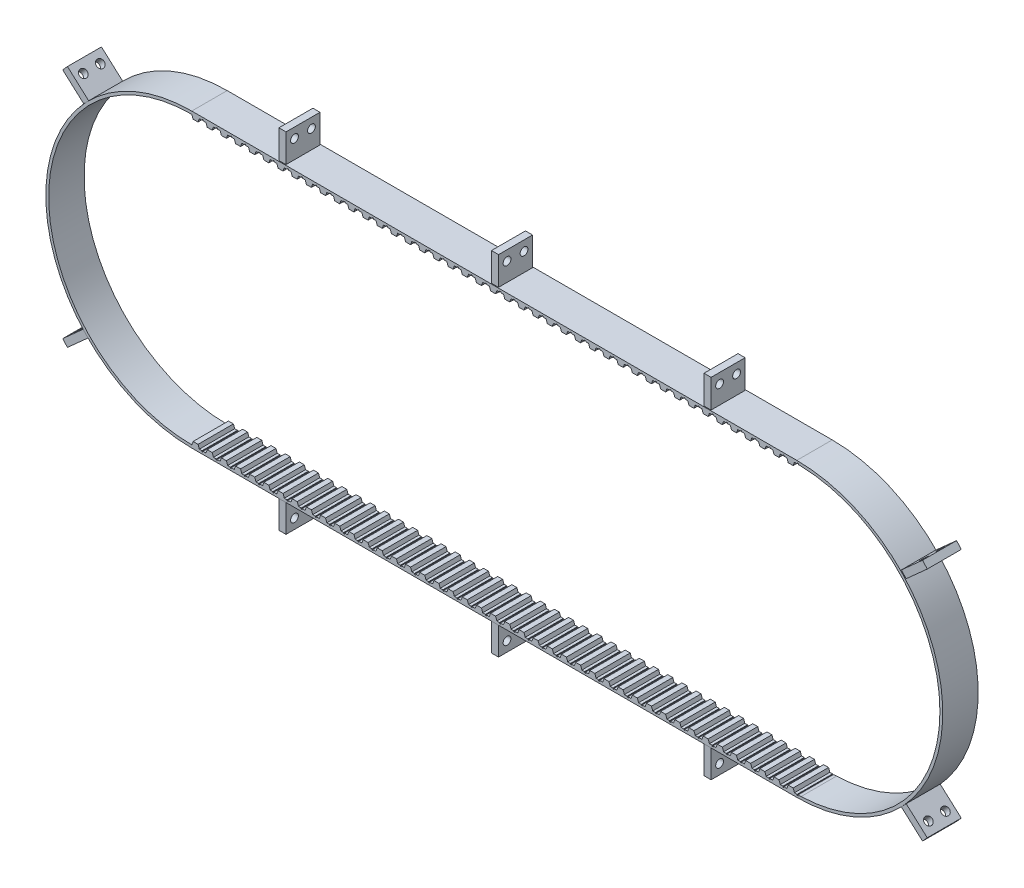
from build123d import *

# Parameters (mm, degrees)
EXTRUDE_1_DEPTH      = 12.5
SKETCH_3_W           = 24
SKETCH_3_H           = 20
SKETCH_3_R           = 2.75
EXTRUDE_2_DEPTH      = 2.5
SKETCH_4_W           = 5
SKETCH_4_H           = 20
EXTRUDE_3_DEPTH      = 24
SKETCH_6_R           = 2.75
CUT_EXTRUDE_2_DEPTH  = 5
SKETCH_5_R           = 2.75
CUT_EXTRUDE_3_DEPTH  = 343.120227406
MIRROR_START         = -152.5
MIRROR_2_OUTLINE_W   = 20
MIRROR_2_OUTLINE_H   = 24
MIRROR_2_OUTLINE_R   = 2.75
MIRROR_2_DEPTH       = 5
MIRROR_START_2       = -2.5
MIRROR_2_2_OUTLINE_W = 20
MIRROR_2_2_OUTLINE_H = 24
MIRROR_2_2_OUTLINE_R = 2.75
MIRROR_2_2_DEPTH     = 5
MIRROR_START_3       = 147.5
MIRROR_2_3_OUTLINE_W = 20
MIRROR_2_3_OUTLINE_H = 24
MIRROR_2_3_OUTLINE_R = 2.75
MIRROR_2_3_DEPTH     = 5
MIRROR_START_4       = 137.535094619
MIRROR_2_4_OUTLINE_W = 20.95281313
MIRROR_2_4_OUTLINE_H = 24
MIRROR_2_4_OUTLINE_R = 2.75
MIRROR_2_4_DEPTH     = 5
MIRROR_START_5       = -142.535094619
MIRROR_2_5_OUTLINE_W = 20.95281313
MIRROR_2_5_OUTLINE_H = 24
MIRROR_2_5_OUTLINE_R = 2.75
MIRROR_2_5_DEPTH     = 5


# Read off the part's stored shape, not the designer's step: 镜向2
with BuildPart() as part:
    # 草图1 → 凸台-拉伸1 (new, symmetric)
    with BuildSketch(Plane.XY):
        with BuildLine():
            Line((-213.5, 103), (213.5, 103))
            ThreePointArc((213.5, 103), (316.5, 0), (213.5, -103))
            Line((213.5, -103), (-213.5, -103))
            ThreePointArc((-213.5, -103), (-316.5, 0), (-213.5, 103))
        make_face()
        with BuildLine():
            Line((-213.5, 101), (-212.590074414, 98.5))
            Line((-212.590074414, 98.5), (-209.090074414, 98.5))
            Line((-209.090074414, 98.5), (-208.180148829, 101))
            Line((-208.180148829, 101), (-206.280148829, 101))
            Line((-206.280148829, 101), (-206.280148829, 101.59))
            Line((-206.280148829, 101.59), (-205.4, 101.59))
            Line((-205.4, 101.59), (-205.4, 101))
            Line((-205.4, 101), (-203.5, 101))
            Line((-203.5, 101), (-202.590074414, 98.5))
            Line((-202.590074414, 98.5), (-199.090074414, 98.5))
            Line((-199.090074414, 98.5), (-198.180148829, 101))
            Line((-198.180148829, 101), (-196.280148829, 101))
            Line((-196.280148829, 101), (-196.280148829, 101.59))
            Line((-196.280148829, 101.59), (-195.4, 101.59))
            Line((-195.4, 101.59), (-195.4, 101))
            Line((-195.4, 101), (-193.5, 101))
            Line((-193.5, 101), (-192.590074414, 98.5))
            Line((-192.590074414, 98.5), (-189.090074414, 98.5))
            Line((-189.090074414, 98.5), (-188.180148829, 101))
            Line((-188.180148829, 101), (-186.280148829, 101))
            Line((-186.280148829, 101), (-186.280148829, 101.59))
            Line((-186.280148829, 101.59), (-185.4, 101.59))
            Line((-185.4, 101.59), (-185.4, 101))
            Line((-185.4, 101), (-183.5, 101))
            Line((-183.5, 101), (-182.590074414, 98.5))
            Line((-182.590074414, 98.5), (-179.090074414, 98.5))
            Line((-179.090074414, 98.5), (-178.180148829, 101))
            Line((-178.180148829, 101), (-176.280148829, 101))
            Line((-176.280148829, 101), (-176.280148829, 101.59))
            Line((-176.280148829, 101.59), (-175.4, 101.59))
            Line((-175.4, 101.59), (-175.4, 101))
            Line((-175.4, 101), (-173.5, 101))
            Line((-173.5, 101), (-172.590074414, 98.5))
            Line((-172.590074414, 98.5), (-169.090074414, 98.5))
            Line((-169.090074414, 98.5), (-168.180148829, 101))
            Line((-168.180148829, 101), (-166.280148829, 101))
            Line((-166.280148829, 101), (-166.280148829, 101.59))
            Line((-166.280148829, 101.59), (-165.4, 101.59))
            Line((-165.4, 101.59), (-165.4, 101))
            Line((-165.4, 101), (-163.5, 101))
            Line((-163.5, 101), (-162.590074414, 98.5))
            Line((-162.590074414, 98.5), (-159.090074414, 98.5))
            Line((-159.090074414, 98.5), (-158.180148829, 101))
            Line((-158.180148829, 101), (-156.280148829, 101))
            Line((-156.280148829, 101), (-156.280148829, 101.59))
            Line((-156.280148829, 101.59), (-155.4, 101.59))
            Line((-155.4, 101.59), (-155.4, 101))
            Line((-155.4, 101), (-153.5, 101))
            Line((-153.5, 101), (-152.590074414, 98.5))
            Line((-152.590074414, 98.5), (-149.090074414, 98.5))
            Line((-149.090074414, 98.5), (-148.180148829, 101))
            Line((-148.180148829, 101), (-146.280148829, 101))
            Line((-146.280148829, 101), (-146.280148829, 101.59))
            Line((-146.280148829, 101.59), (-145.4, 101.59))
            Line((-145.4, 101.59), (-145.4, 101))
            Line((-145.4, 101), (-143.5, 101))
            Line((-143.5, 101), (-142.590074414, 98.5))
            Line((-142.590074414, 98.5), (-139.090074414, 98.5))
            Line((-139.090074414, 98.5), (-138.180148829, 101))
            Line((-138.180148829, 101), (-136.280148829, 101))
            Line((-136.280148829, 101), (-136.280148829, 101.59))
            Line((-136.280148829, 101.59), (-135.4, 101.59))
            Line((-135.4, 101.59), (-135.4, 101))
            Line((-135.4, 101), (-133.5, 101))
            Line((-133.5, 101), (-132.590074414, 98.5))
            Line((-132.590074414, 98.5), (-129.090074414, 98.5))
            Line((-129.090074414, 98.5), (-128.180148829, 101))
            Line((-128.180148829, 101), (-126.280148829, 101))
            Line((-126.280148829, 101), (-126.280148829, 101.59))
            Line((-126.280148829, 101.59), (-125.4, 101.59))
            Line((-125.4, 101.59), (-125.4, 101))
            Line((-125.4, 101), (-123.5, 101))
            Line((-123.5, 101), (-122.590074414, 98.5))
            Line((-122.590074414, 98.5), (-119.090074414, 98.5))
            Line((-119.090074414, 98.5), (-118.180148829, 101))
            Line((-118.180148829, 101), (-116.280148829, 101))
            Line((-116.280148829, 101), (-116.280148829, 101.59))
            Line((-116.280148829, 101.59), (-115.4, 101.59))
            Line((-115.4, 101.59), (-115.4, 101))
            Line((-115.4, 101), (-113.5, 101))
            Line((-113.5, 101), (-112.590074414, 98.5))
            Line((-112.590074414, 98.5), (-109.090074414, 98.5))
            Line((-109.090074414, 98.5), (-108.180148829, 101))
            Line((-108.180148829, 101), (-106.280148829, 101))
            Line((-106.280148829, 101), (-106.280148829, 101.59))
            Line((-106.280148829, 101.59), (-105.4, 101.59))
            Line((-105.4, 101.59), (-105.4, 101))
            Line((-105.4, 101), (-103.5, 101))
            Line((-103.5, 101), (-102.590074414, 98.5))
            Line((-102.590074414, 98.5), (-99.090074414, 98.5))
            Line((-99.090074414, 98.5), (-98.180148829, 101))
            Line((-98.180148829, 101), (-96.280148829, 101))
            Line((-96.280148829, 101), (-96.280148829, 101.59))
            Line((-96.280148829, 101.59), (-95.4, 101.59))
            Line((-95.4, 101.59), (-95.4, 101))
            Line((-95.4, 101), (-93.5, 101))
            Line((-93.5, 101), (-92.590074414, 98.5))
            Line((-92.590074414, 98.5), (-89.090074414, 98.5))
            Line((-89.090074414, 98.5), (-88.180148829, 101))
            Line((-88.180148829, 101), (-86.280148829, 101))
            Line((-86.280148829, 101), (-86.280148829, 101.59))
            Line((-86.280148829, 101.59), (-85.4, 101.59))
            Line((-85.4, 101.59), (-85.4, 101))
            Line((-85.4, 101), (-83.5, 101))
            Line((-83.5, 101), (-82.590074414, 98.5))
            Line((-82.590074414, 98.5), (-79.090074414, 98.5))
            Line((-79.090074414, 98.5), (-78.180148829, 101))
            Line((-78.180148829, 101), (-76.280148829, 101))
            Line((-76.280148829, 101), (-76.280148829, 101.59))
            Line((-76.280148829, 101.59), (-75.4, 101.59))
            Line((-75.4, 101.59), (-75.4, 101))
            Line((-75.4, 101), (-73.5, 101))
            Line((-73.5, 101), (-72.590074414, 98.5))
            Line((-72.590074414, 98.5), (-69.090074414, 98.5))
            Line((-69.090074414, 98.5), (-68.180148829, 101))
            Line((-68.180148829, 101), (-66.280148829, 101))
            Line((-66.280148829, 101), (-66.280148829, 101.59))
            Line((-66.280148829, 101.59), (-65.4, 101.59))
            Line((-65.4, 101.59), (-65.4, 101))
            Line((-65.4, 101), (-63.5, 101))
            Line((-63.5, 101), (-62.590074414, 98.5))
            Line((-62.590074414, 98.5), (-59.090074414, 98.5))
            Line((-59.090074414, 98.5), (-58.180148829, 101))
            Line((-58.180148829, 101), (-56.280148829, 101))
            Line((-56.280148829, 101), (-56.280148829, 101.59))
            Line((-56.280148829, 101.59), (-55.4, 101.59))
            Line((-55.4, 101.59), (-55.4, 101))
            Line((-55.4, 101), (-53.5, 101))
            Line((-53.5, 101), (-52.590074414, 98.5))
            Line((-52.590074414, 98.5), (-49.090074414, 98.5))
            Line((-49.090074414, 98.5), (-48.180148829, 101))
            Line((-48.180148829, 101), (-46.280148829, 101))
            Line((-46.280148829, 101), (-46.280148829, 101.59))
            Line((-46.280148829, 101.59), (-45.4, 101.59))
            Line((-45.4, 101.59), (-45.4, 101))
            Line((-45.4, 101), (-43.5, 101))
            Line((-43.5, 101), (-42.590074414, 98.5))
            Line((-42.590074414, 98.5), (-39.090074414, 98.5))
            Line((-39.090074414, 98.5), (-38.180148829, 101))
            Line((-38.180148829, 101), (-36.280148829, 101))
            Line((-36.280148829, 101), (-36.280148829, 101.59))
            Line((-36.280148829, 101.59), (-35.4, 101.59))
            Line((-35.4, 101.59), (-35.4, 101))
            Line((-35.4, 101), (-33.5, 101))
            Line((-33.5, 101), (-32.590074414, 98.5))
            Line((-32.590074414, 98.5), (-29.090074414, 98.5))
            Line((-29.090074414, 98.5), (-28.180148829, 101))
            Line((-28.180148829, 101), (-26.280148829, 101))
            Line((-26.280148829, 101), (-26.280148829, 101.59))
            Line((-26.280148829, 101.59), (-25.4, 101.59))
            Line((-25.4, 101.59), (-25.4, 101))
            Line((-25.4, 101), (-23.5, 101))
            Line((-23.5, 101), (-22.590074414, 98.5))
            Line((-22.590074414, 98.5), (-19.090074414, 98.5))
            Line((-19.090074414, 98.5), (-18.180148829, 101))
            Line((-18.180148829, 101), (-16.280148829, 101))
            Line((-16.280148829, 101), (-16.280148829, 101.59))
            Line((-16.280148829, 101.59), (-15.4, 101.59))
            Line((-15.4, 101.59), (-15.4, 101))
            Line((-15.4, 101), (-13.5, 101))
            Line((-13.5, 101), (-12.590074414, 98.5))
            Line((-12.590074414, 98.5), (-9.090074414, 98.5))
            Line((-9.090074414, 98.5), (-8.180148829, 101))
            Line((-8.180148829, 101), (-6.280148829, 101))
            Line((-6.280148829, 101), (-6.280148829, 101.59))
            Line((-6.280148829, 101.59), (-5.4, 101.59))
            Line((-5.4, 101.59), (-5.4, 101))
            Line((-5.4, 101), (-3.5, 101))
            Line((-3.5, 101), (-2.590074414, 98.5))
            Line((-2.590074414, 98.5), (0.909925586, 98.5))
            Line((0.909925586, 98.5), (1.819851171, 101))
            Line((1.819851171, 101), (3.719851171, 101))
            Line((3.719851171, 101), (3.719851171, 101.59))
            Line((3.719851171, 101.59), (4.6, 101.59))
            Line((4.6, 101.59), (4.6, 101))
            Line((4.6, 101), (6.5, 101))
            Line((6.5, 101), (7.409925586, 98.5))
            Line((7.409925586, 98.5), (10.909925586, 98.5))
            Line((10.909925586, 98.5), (11.819851171, 101))
            Line((11.819851171, 101), (13.719851171, 101))
            Line((13.719851171, 101), (13.719851171, 101.59))
            Line((13.719851171, 101.59), (14.6, 101.59))
            Line((14.6, 101.59), (14.6, 101))
            Line((14.6, 101), (16.5, 101))
            Line((16.5, 101), (17.409925586, 98.5))
            Line((17.409925586, 98.5), (20.909925586, 98.5))
            Line((20.909925586, 98.5), (21.819851171, 101))
            Line((21.819851171, 101), (23.719851171, 101))
            Line((23.719851171, 101), (23.719851171, 101.59))
            Line((23.719851171, 101.59), (24.6, 101.59))
            Line((24.6, 101.59), (24.6, 101))
            Line((24.6, 101), (26.5, 101))
            Line((26.5, 101), (27.409925586, 98.5))
            Line((27.409925586, 98.5), (30.909925586, 98.5))
            Line((30.909925586, 98.5), (31.819851171, 101))
            Line((31.819851171, 101), (33.719851171, 101))
            Line((33.719851171, 101), (33.719851171, 101.59))
            Line((33.719851171, 101.59), (34.6, 101.59))
            Line((34.6, 101.59), (34.6, 101))
            Line((34.6, 101), (36.5, 101))
            Line((36.5, 101), (37.409925586, 98.5))
            Line((37.409925586, 98.5), (40.909925586, 98.5))
            Line((40.909925586, 98.5), (41.819851171, 101))
            Line((41.819851171, 101), (43.719851171, 101))
            Line((43.719851171, 101), (43.719851171, 101.59))
            Line((43.719851171, 101.59), (44.6, 101.59))
            Line((44.6, 101.59), (44.6, 101))
            Line((44.6, 101), (46.5, 101))
            Line((46.5, 101), (47.409925586, 98.5))
            Line((47.409925586, 98.5), (50.909925586, 98.5))
            Line((50.909925586, 98.5), (51.819851171, 101))
            Line((51.819851171, 101), (53.719851171, 101))
            Line((53.719851171, 101), (53.719851171, 101.59))
            Line((53.719851171, 101.59), (54.6, 101.59))
            Line((54.6, 101.59), (54.6, 101))
            Line((54.6, 101), (56.5, 101))
            Line((56.5, 101), (57.409925586, 98.5))
            Line((57.409925586, 98.5), (60.909925586, 98.5))
            Line((60.909925586, 98.5), (61.819851171, 101))
            Line((61.819851171, 101), (63.719851171, 101))
            Line((63.719851171, 101), (63.719851171, 101.59))
            Line((63.719851171, 101.59), (64.6, 101.59))
            Line((64.6, 101.59), (64.6, 101))
            Line((64.6, 101), (66.5, 101))
            Line((66.5, 101), (67.409925586, 98.5))
            Line((67.409925586, 98.5), (70.909925586, 98.5))
            Line((70.909925586, 98.5), (71.819851171, 101))
            Line((71.819851171, 101), (73.719851171, 101))
            Line((73.719851171, 101), (73.719851171, 101.59))
            Line((73.719851171, 101.59), (74.6, 101.59))
            Line((74.6, 101.59), (74.6, 101))
            Line((74.6, 101), (76.5, 101))
            Line((76.5, 101), (77.409925586, 98.5))
            Line((77.409925586, 98.5), (80.909925586, 98.5))
            Line((80.909925586, 98.5), (81.819851171, 101))
            Line((81.819851171, 101), (83.719851171, 101))
            Line((83.719851171, 101), (83.719851171, 101.59))
            Line((83.719851171, 101.59), (84.6, 101.59))
            Line((84.6, 101.59), (84.6, 101))
            Line((84.6, 101), (86.5, 101))
            Line((86.5, 101), (87.409925586, 98.5))
            Line((87.409925586, 98.5), (90.909925586, 98.5))
            Line((90.909925586, 98.5), (91.819851171, 101))
            Line((91.819851171, 101), (93.719851171, 101))
            Line((93.719851171, 101), (93.719851171, 101.59))
            Line((93.719851171, 101.59), (94.6, 101.59))
            Line((94.6, 101.59), (94.6, 101))
            Line((94.6, 101), (96.5, 101))
            Line((96.5, 101), (97.409925586, 98.5))
            Line((97.409925586, 98.5), (100.909925586, 98.5))
            Line((100.909925586, 98.5), (101.819851171, 101))
            Line((101.819851171, 101), (103.719851171, 101))
            Line((103.719851171, 101), (103.719851171, 101.59))
            Line((103.719851171, 101.59), (104.6, 101.59))
            Line((104.6, 101.59), (104.6, 101))
            Line((104.6, 101), (106.5, 101))
            Line((106.5, 101), (107.409925586, 98.5))
            Line((107.409925586, 98.5), (110.909925586, 98.5))
            Line((110.909925586, 98.5), (111.819851171, 101))
            Line((111.819851171, 101), (113.719851171, 101))
            Line((113.719851171, 101), (113.719851171, 101.59))
            Line((113.719851171, 101.59), (114.6, 101.59))
            Line((114.6, 101.59), (114.6, 101))
            Line((114.6, 101), (116.5, 101))
            Line((116.5, 101), (117.409925586, 98.5))
            Line((117.409925586, 98.5), (120.909925586, 98.5))
            Line((120.909925586, 98.5), (121.819851171, 101))
            Line((121.819851171, 101), (123.719851171, 101))
            Line((123.719851171, 101), (123.719851171, 101.59))
            Line((123.719851171, 101.59), (124.6, 101.59))
            Line((124.6, 101.59), (124.6, 101))
            Line((124.6, 101), (126.5, 101))
            Line((126.5, 101), (127.409925586, 98.5))
            Line((127.409925586, 98.5), (130.909925586, 98.5))
            Line((130.909925586, 98.5), (131.819851171, 101))
            Line((131.819851171, 101), (133.719851171, 101))
            Line((133.719851171, 101), (133.719851171, 101.59))
            Line((133.719851171, 101.59), (134.6, 101.59))
            Line((134.6, 101.59), (134.6, 101))
            Line((134.6, 101), (136.5, 101))
            Line((136.5, 101), (137.409925586, 98.5))
            Line((137.409925586, 98.5), (140.909925586, 98.5))
            Line((140.909925586, 98.5), (141.819851171, 101))
            Line((141.819851171, 101), (143.719851171, 101))
            Line((143.719851171, 101), (143.719851171, 101.59))
            Line((143.719851171, 101.59), (144.6, 101.59))
            Line((144.6, 101.59), (144.6, 101))
            Line((144.6, 101), (146.5, 101))
            Line((146.5, 101), (147.409925586, 98.5))
            Line((147.409925586, 98.5), (150.909925586, 98.5))
            Line((150.909925586, 98.5), (151.819851171, 101))
            Line((151.819851171, 101), (153.719851171, 101))
            Line((153.719851171, 101), (153.719851171, 101.59))
            Line((153.719851171, 101.59), (154.6, 101.59))
            Line((154.6, 101.59), (154.6, 101))
            Line((154.6, 101), (156.5, 101))
            Line((156.5, 101), (157.409925586, 98.5))
            Line((157.409925586, 98.5), (160.909925586, 98.5))
            Line((160.909925586, 98.5), (161.819851171, 101))
            Line((161.819851171, 101), (163.719851171, 101))
            Line((163.719851171, 101), (163.719851171, 101.59))
            Line((163.719851171, 101.59), (164.6, 101.59))
            Line((164.6, 101.59), (164.6, 101))
            Line((164.6, 101), (166.5, 101))
            Line((166.5, 101), (167.409925586, 98.5))
            Line((167.409925586, 98.5), (170.909925586, 98.5))
            Line((170.909925586, 98.5), (171.819851171, 101))
            Line((171.819851171, 101), (173.719851171, 101))
            Line((173.719851171, 101), (173.719851171, 101.59))
            Line((173.719851171, 101.59), (174.6, 101.59))
            Line((174.6, 101.59), (174.6, 101))
            Line((174.6, 101), (176.5, 101))
            Line((176.5, 101), (177.409925586, 98.5))
            Line((177.409925586, 98.5), (180.909925586, 98.5))
            Line((180.909925586, 98.5), (181.819851171, 101))
            Line((181.819851171, 101), (183.719851171, 101))
            Line((183.719851171, 101), (183.719851171, 101.59))
            Line((183.719851171, 101.59), (184.6, 101.59))
            Line((184.6, 101.59), (184.6, 101))
            Line((184.6, 101), (186.5, 101))
            Line((186.5, 101), (187.409925586, 98.5))
            Line((187.409925586, 98.5), (190.909925586, 98.5))
            Line((190.909925586, 98.5), (191.819851171, 101))
            Line((191.819851171, 101), (193.719851171, 101))
            Line((193.719851171, 101), (193.719851171, 101.59))
            Line((193.719851171, 101.59), (194.6, 101.59))
            Line((194.6, 101.59), (194.6, 101))
            Line((194.6, 101), (196.5, 101))
            Line((196.5, 101), (197.409925586, 98.5))
            Line((197.409925586, 98.5), (200.909925586, 98.5))
            Line((200.909925586, 98.5), (201.819851171, 101))
            Line((201.819851171, 101), (203.719851171, 101))
            Line((203.719851171, 101), (203.719851171, 101.59))
            Line((203.719851171, 101.59), (204.6, 101.59))
            Line((204.6, 101.59), (204.6, 101))
            Line((204.6, 101), (206.5, 101))
            Line((206.5, 101), (207.409925586, 98.5))
            Line((207.409925586, 98.5), (210.909925586, 98.5))
            Line((210.909925586, 98.5), (211.819851171, 101))
            Line((211.819851171, 101), (213.719851171, 101))
            Line((213.719851171, 101), (213.719851171, 101.59))
            Line((213.719851171, 101.59), (214.6, 101.59))
            Line((214.6, 101.59), (214.6, 101))
            Line((214.6, 101), (216.5, 101))
            Line((216.5, 101), (216.516397915, 100.954947098))
            ThreePointArc((216.516397915, 100.954947098), (314.5, 0), (216.516397915, -100.954947098))
            Line((216.516397915, -100.954947098), (216.5, -101))
            Line((216.5, -101), (214.6, -101))
            Line((214.6, -101), (214.6, -101.59))
            Line((214.6, -101.59), (213.719851171, -101.59))
            Line((213.719851171, -101.59), (213.719851171, -101))
            Line((213.719851171, -101), (211.819851171, -101))
            Line((211.819851171, -101), (210.909925586, -98.5))
            Line((210.909925586, -98.5), (207.409925586, -98.5))
            Line((207.409925586, -98.5), (206.5, -101))
            Line((206.5, -101), (204.6, -101))
            Line((204.6, -101), (204.6, -101.59))
            Line((204.6, -101.59), (203.719851171, -101.59))
            Line((203.719851171, -101.59), (203.719851171, -101))
            Line((203.719851171, -101), (201.819851171, -101))
            Line((201.819851171, -101), (200.909925586, -98.5))
            Line((200.909925586, -98.5), (197.409925586, -98.5))
            Line((197.409925586, -98.5), (196.5, -101))
            Line((196.5, -101), (194.6, -101))
            Line((194.6, -101), (194.6, -101.59))
            Line((194.6, -101.59), (193.719851171, -101.59))
            Line((193.719851171, -101.59), (193.719851171, -101))
            Line((193.719851171, -101), (191.819851171, -101))
            Line((191.819851171, -101), (190.909925586, -98.5))
            Line((190.909925586, -98.5), (187.409925586, -98.5))
            Line((187.409925586, -98.5), (186.5, -101))
            Line((186.5, -101), (184.6, -101))
            Line((184.6, -101), (184.6, -101.59))
            Line((184.6, -101.59), (183.719851171, -101.59))
            Line((183.719851171, -101.59), (183.719851171, -101))
            Line((183.719851171, -101), (181.819851171, -101))
            Line((181.819851171, -101), (180.909925586, -98.5))
            Line((180.909925586, -98.5), (177.409925586, -98.5))
            Line((177.409925586, -98.5), (176.5, -101))
            Line((176.5, -101), (174.6, -101))
            Line((174.6, -101), (174.6, -101.59))
            Line((174.6, -101.59), (173.719851171, -101.59))
            Line((173.719851171, -101.59), (173.719851171, -101))
            Line((173.719851171, -101), (171.819851171, -101))
            Line((171.819851171, -101), (170.909925586, -98.5))
            Line((170.909925586, -98.5), (167.409925586, -98.5))
            Line((167.409925586, -98.5), (166.5, -101))
            Line((166.5, -101), (164.6, -101))
            Line((164.6, -101), (164.6, -101.59))
            Line((164.6, -101.59), (163.719851171, -101.59))
            Line((163.719851171, -101.59), (163.719851171, -101))
            Line((163.719851171, -101), (161.819851171, -101))
            Line((161.819851171, -101), (160.909925586, -98.5))
            Line((160.909925586, -98.5), (157.409925586, -98.5))
            Line((157.409925586, -98.5), (156.5, -101))
            Line((156.5, -101), (154.6, -101))
            Line((154.6, -101), (154.6, -101.59))
            Line((154.6, -101.59), (153.719851171, -101.59))
            Line((153.719851171, -101.59), (153.719851171, -101))
            Line((153.719851171, -101), (151.819851171, -101))
            Line((151.819851171, -101), (150.909925586, -98.5))
            Line((150.909925586, -98.5), (147.409925586, -98.5))
            Line((147.409925586, -98.5), (146.5, -101))
            Line((146.5, -101), (144.6, -101))
            Line((144.6, -101), (144.6, -101.59))
            Line((144.6, -101.59), (143.719851171, -101.59))
            Line((143.719851171, -101.59), (143.719851171, -101))
            Line((143.719851171, -101), (141.819851171, -101))
            Line((141.819851171, -101), (140.909925586, -98.5))
            Line((140.909925586, -98.5), (137.409925586, -98.5))
            Line((137.409925586, -98.5), (136.5, -101))
            Line((136.5, -101), (134.6, -101))
            Line((134.6, -101), (134.6, -101.59))
            Line((134.6, -101.59), (133.719851171, -101.59))
            Line((133.719851171, -101.59), (133.719851171, -101))
            Line((133.719851171, -101), (131.819851171, -101))
            Line((131.819851171, -101), (130.909925586, -98.5))
            Line((130.909925586, -98.5), (127.409925586, -98.5))
            Line((127.409925586, -98.5), (126.5, -101))
            Line((126.5, -101), (124.6, -101))
            Line((124.6, -101), (124.6, -101.59))
            Line((124.6, -101.59), (123.719851171, -101.59))
            Line((123.719851171, -101.59), (123.719851171, -101))
            Line((123.719851171, -101), (121.819851171, -101))
            Line((121.819851171, -101), (120.909925586, -98.5))
            Line((120.909925586, -98.5), (117.409925586, -98.5))
            Line((117.409925586, -98.5), (116.5, -101))
            Line((116.5, -101), (114.6, -101))
            Line((114.6, -101), (114.6, -101.59))
            Line((114.6, -101.59), (113.719851171, -101.59))
            Line((113.719851171, -101.59), (113.719851171, -101))
            Line((113.719851171, -101), (111.819851171, -101))
            Line((111.819851171, -101), (110.909925586, -98.5))
            Line((110.909925586, -98.5), (107.409925586, -98.5))
            Line((107.409925586, -98.5), (106.5, -101))
            Line((106.5, -101), (104.6, -101))
            Line((104.6, -101), (104.6, -101.59))
            Line((104.6, -101.59), (103.719851171, -101.59))
            Line((103.719851171, -101.59), (103.719851171, -101))
            Line((103.719851171, -101), (101.819851171, -101))
            Line((101.819851171, -101), (100.909925586, -98.5))
            Line((100.909925586, -98.5), (97.409925586, -98.5))
            Line((97.409925586, -98.5), (96.5, -101))
            Line((96.5, -101), (94.6, -101))
            Line((94.6, -101), (94.6, -101.59))
            Line((94.6, -101.59), (93.719851171, -101.59))
            Line((93.719851171, -101.59), (93.719851171, -101))
            Line((93.719851171, -101), (91.819851171, -101))
            Line((91.819851171, -101), (90.909925586, -98.5))
            Line((90.909925586, -98.5), (87.409925586, -98.5))
            Line((87.409925586, -98.5), (86.5, -101))
            Line((86.5, -101), (84.6, -101))
            Line((84.6, -101), (84.6, -101.59))
            Line((84.6, -101.59), (83.719851171, -101.59))
            Line((83.719851171, -101.59), (83.719851171, -101))
            Line((83.719851171, -101), (81.819851171, -101))
            Line((81.819851171, -101), (80.909925586, -98.5))
            Line((80.909925586, -98.5), (77.409925586, -98.5))
            Line((77.409925586, -98.5), (76.5, -101))
            Line((76.5, -101), (74.6, -101))
            Line((74.6, -101), (74.6, -101.59))
            Line((74.6, -101.59), (73.719851171, -101.59))
            Line((73.719851171, -101.59), (73.719851171, -101))
            Line((73.719851171, -101), (71.819851171, -101))
            Line((71.819851171, -101), (70.909925586, -98.5))
            Line((70.909925586, -98.5), (67.409925586, -98.5))
            Line((67.409925586, -98.5), (66.5, -101))
            Line((66.5, -101), (64.6, -101))
            Line((64.6, -101), (64.6, -101.59))
            Line((64.6, -101.59), (63.719851171, -101.59))
            Line((63.719851171, -101.59), (63.719851171, -101))
            Line((63.719851171, -101), (61.819851171, -101))
            Line((61.819851171, -101), (60.909925586, -98.5))
            Line((60.909925586, -98.5), (57.409925586, -98.5))
            Line((57.409925586, -98.5), (56.5, -101))
            Line((56.5, -101), (54.6, -101))
            Line((54.6, -101), (54.6, -101.59))
            Line((54.6, -101.59), (53.719851171, -101.59))
            Line((53.719851171, -101.59), (53.719851171, -101))
            Line((53.719851171, -101), (51.819851171, -101))
            Line((51.819851171, -101), (50.909925586, -98.5))
            Line((50.909925586, -98.5), (47.409925586, -98.5))
            Line((47.409925586, -98.5), (46.5, -101))
            Line((46.5, -101), (44.6, -101))
            Line((44.6, -101), (44.6, -101.59))
            Line((44.6, -101.59), (43.719851171, -101.59))
            Line((43.719851171, -101.59), (43.719851171, -101))
            Line((43.719851171, -101), (41.819851171, -101))
            Line((41.819851171, -101), (40.909925586, -98.5))
            Line((40.909925586, -98.5), (37.409925586, -98.5))
            Line((37.409925586, -98.5), (36.5, -101))
            Line((36.5, -101), (34.6, -101))
            Line((34.6, -101), (34.6, -101.59))
            Line((34.6, -101.59), (33.719851171, -101.59))
            Line((33.719851171, -101.59), (33.719851171, -101))
            Line((33.719851171, -101), (31.819851171, -101))
            Line((31.819851171, -101), (30.909925586, -98.5))
            Line((30.909925586, -98.5), (27.409925586, -98.5))
            Line((27.409925586, -98.5), (26.5, -101))
            Line((26.5, -101), (24.6, -101))
            Line((24.6, -101), (24.6, -101.59))
            Line((24.6, -101.59), (23.719851171, -101.59))
            Line((23.719851171, -101.59), (23.719851171, -101))
            Line((23.719851171, -101), (21.819851171, -101))
            Line((21.819851171, -101), (20.909925586, -98.5))
            Line((20.909925586, -98.5), (17.409925586, -98.5))
            Line((17.409925586, -98.5), (16.5, -101))
            Line((16.5, -101), (14.6, -101))
            Line((14.6, -101), (14.6, -101.59))
            Line((14.6, -101.59), (13.719851171, -101.59))
            Line((13.719851171, -101.59), (13.719851171, -101))
            Line((13.719851171, -101), (11.819851171, -101))
            Line((11.819851171, -101), (10.909925586, -98.5))
            Line((10.909925586, -98.5), (7.409925586, -98.5))
            Line((7.409925586, -98.5), (6.5, -101))
            Line((6.5, -101), (4.6, -101))
            Line((4.6, -101), (4.6, -101.59))
            Line((4.6, -101.59), (3.719851171, -101.59))
            Line((3.719851171, -101.59), (3.719851171, -101))
            Line((3.719851171, -101), (1.819851171, -101))
            Line((1.819851171, -101), (0.909925586, -98.5))
            Line((0.909925586, -98.5), (-2.590074414, -98.5))
            Line((-2.590074414, -98.5), (-3.5, -101))
            Line((-3.5, -101), (-5.4, -101))
            Line((-5.4, -101), (-5.4, -101.59))
            Line((-5.4, -101.59), (-6.280148829, -101.59))
            Line((-6.280148829, -101.59), (-6.280148829, -101))
            Line((-6.280148829, -101), (-8.180148829, -101))
            Line((-8.180148829, -101), (-9.090074414, -98.5))
            Line((-9.090074414, -98.5), (-12.590074414, -98.5))
            Line((-12.590074414, -98.5), (-13.5, -101))
            Line((-13.5, -101), (-15.4, -101))
            Line((-15.4, -101), (-15.4, -101.59))
            Line((-15.4, -101.59), (-16.280148829, -101.59))
            Line((-16.280148829, -101.59), (-16.280148829, -101))
            Line((-16.280148829, -101), (-18.180148829, -101))
            Line((-18.180148829, -101), (-19.090074414, -98.5))
            Line((-19.090074414, -98.5), (-22.590074414, -98.5))
            Line((-22.590074414, -98.5), (-23.5, -101))
            Line((-23.5, -101), (-25.4, -101))
            Line((-25.4, -101), (-25.4, -101.59))
            Line((-25.4, -101.59), (-26.280148829, -101.59))
            Line((-26.280148829, -101.59), (-26.280148829, -101))
            Line((-26.280148829, -101), (-28.180148829, -101))
            Line((-28.180148829, -101), (-29.090074414, -98.5))
            Line((-29.090074414, -98.5), (-32.590074414, -98.5))
            Line((-32.590074414, -98.5), (-33.5, -101))
            Line((-33.5, -101), (-35.4, -101))
            Line((-35.4, -101), (-35.4, -101.59))
            Line((-35.4, -101.59), (-36.280148829, -101.59))
            Line((-36.280148829, -101.59), (-36.280148829, -101))
            Line((-36.280148829, -101), (-38.180148829, -101))
            Line((-38.180148829, -101), (-39.090074414, -98.5))
            Line((-39.090074414, -98.5), (-42.590074414, -98.5))
            Line((-42.590074414, -98.5), (-43.5, -101))
            Line((-43.5, -101), (-45.4, -101))
            Line((-45.4, -101), (-45.4, -101.59))
            Line((-45.4, -101.59), (-46.280148829, -101.59))
            Line((-46.280148829, -101.59), (-46.280148829, -101))
            Line((-46.280148829, -101), (-48.180148829, -101))
            Line((-48.180148829, -101), (-49.090074414, -98.5))
            Line((-49.090074414, -98.5), (-52.590074414, -98.5))
            Line((-52.590074414, -98.5), (-53.5, -101))
            Line((-53.5, -101), (-55.4, -101))
            Line((-55.4, -101), (-55.4, -101.59))
            Line((-55.4, -101.59), (-56.280148829, -101.59))
            Line((-56.280148829, -101.59), (-56.280148829, -101))
            Line((-56.280148829, -101), (-58.180148829, -101))
            Line((-58.180148829, -101), (-59.090074414, -98.5))
            Line((-59.090074414, -98.5), (-62.590074414, -98.5))
            Line((-62.590074414, -98.5), (-63.5, -101))
            Line((-63.5, -101), (-65.4, -101))
            Line((-65.4, -101), (-65.4, -101.59))
            Line((-65.4, -101.59), (-66.280148829, -101.59))
            Line((-66.280148829, -101.59), (-66.280148829, -101))
            Line((-66.280148829, -101), (-68.180148829, -101))
            Line((-68.180148829, -101), (-69.090074414, -98.5))
            Line((-69.090074414, -98.5), (-72.590074414, -98.5))
            Line((-72.590074414, -98.5), (-73.5, -101))
            Line((-73.5, -101), (-75.4, -101))
            Line((-75.4, -101), (-75.4, -101.59))
            Line((-75.4, -101.59), (-76.280148829, -101.59))
            Line((-76.280148829, -101.59), (-76.280148829, -101))
            Line((-76.280148829, -101), (-78.180148829, -101))
            Line((-78.180148829, -101), (-79.090074414, -98.5))
            Line((-79.090074414, -98.5), (-82.590074414, -98.5))
            Line((-82.590074414, -98.5), (-83.5, -101))
            Line((-83.5, -101), (-85.4, -101))
            Line((-85.4, -101), (-85.4, -101.59))
            Line((-85.4, -101.59), (-86.280148829, -101.59))
            Line((-86.280148829, -101.59), (-86.280148829, -101))
            Line((-86.280148829, -101), (-88.180148829, -101))
            Line((-88.180148829, -101), (-89.090074414, -98.5))
            Line((-89.090074414, -98.5), (-92.590074414, -98.5))
            Line((-92.590074414, -98.5), (-93.5, -101))
            Line((-93.5, -101), (-95.4, -101))
            Line((-95.4, -101), (-95.4, -101.59))
            Line((-95.4, -101.59), (-96.280148829, -101.59))
            Line((-96.280148829, -101.59), (-96.280148829, -101))
            Line((-96.280148829, -101), (-98.180148829, -101))
            Line((-98.180148829, -101), (-99.090074414, -98.5))
            Line((-99.090074414, -98.5), (-102.590074414, -98.5))
            Line((-102.590074414, -98.5), (-103.5, -101))
            Line((-103.5, -101), (-105.4, -101))
            Line((-105.4, -101), (-105.4, -101.59))
            Line((-105.4, -101.59), (-106.280148829, -101.59))
            Line((-106.280148829, -101.59), (-106.280148829, -101))
            Line((-106.280148829, -101), (-108.180148829, -101))
            Line((-108.180148829, -101), (-109.090074414, -98.5))
            Line((-109.090074414, -98.5), (-112.590074414, -98.5))
            Line((-112.590074414, -98.5), (-113.5, -101))
            Line((-113.5, -101), (-115.4, -101))
            Line((-115.4, -101), (-115.4, -101.59))
            Line((-115.4, -101.59), (-116.280148829, -101.59))
            Line((-116.280148829, -101.59), (-116.280148829, -101))
            Line((-116.280148829, -101), (-118.180148829, -101))
            Line((-118.180148829, -101), (-119.090074414, -98.5))
            Line((-119.090074414, -98.5), (-122.590074414, -98.5))
            Line((-122.590074414, -98.5), (-123.5, -101))
            Line((-123.5, -101), (-125.4, -101))
            Line((-125.4, -101), (-125.4, -101.59))
            Line((-125.4, -101.59), (-126.280148829, -101.59))
            Line((-126.280148829, -101.59), (-126.280148829, -101))
            Line((-126.280148829, -101), (-128.180148829, -101))
            Line((-128.180148829, -101), (-129.090074414, -98.5))
            Line((-129.090074414, -98.5), (-132.590074414, -98.5))
            Line((-132.590074414, -98.5), (-133.5, -101))
            Line((-133.5, -101), (-135.4, -101))
            Line((-135.4, -101), (-135.4, -101.59))
            Line((-135.4, -101.59), (-136.280148829, -101.59))
            Line((-136.280148829, -101.59), (-136.280148829, -101))
            Line((-136.280148829, -101), (-138.180148829, -101))
            Line((-138.180148829, -101), (-139.090074414, -98.5))
            Line((-139.090074414, -98.5), (-142.590074414, -98.5))
            Line((-142.590074414, -98.5), (-143.5, -101))
            Line((-143.5, -101), (-145.4, -101))
            Line((-145.4, -101), (-145.4, -101.59))
            Line((-145.4, -101.59), (-146.280148829, -101.59))
            Line((-146.280148829, -101.59), (-146.280148829, -101))
            Line((-146.280148829, -101), (-148.180148829, -101))
            Line((-148.180148829, -101), (-149.090074414, -98.5))
            Line((-149.090074414, -98.5), (-152.590074414, -98.5))
            Line((-152.590074414, -98.5), (-153.5, -101))
            Line((-153.5, -101), (-155.4, -101))
            Line((-155.4, -101), (-155.4, -101.59))
            Line((-155.4, -101.59), (-156.280148829, -101.59))
            Line((-156.280148829, -101.59), (-156.280148829, -101))
            Line((-156.280148829, -101), (-158.180148829, -101))
            Line((-158.180148829, -101), (-159.090074414, -98.5))
            Line((-159.090074414, -98.5), (-162.590074414, -98.5))
            Line((-162.590074414, -98.5), (-163.5, -101))
            Line((-163.5, -101), (-165.4, -101))
            Line((-165.4, -101), (-165.4, -101.59))
            Line((-165.4, -101.59), (-166.280148829, -101.59))
            Line((-166.280148829, -101.59), (-166.280148829, -101))
            Line((-166.280148829, -101), (-168.180148829, -101))
            Line((-168.180148829, -101), (-169.090074414, -98.5))
            Line((-169.090074414, -98.5), (-172.590074414, -98.5))
            Line((-172.590074414, -98.5), (-173.5, -101))
            Line((-173.5, -101), (-175.4, -101))
            Line((-175.4, -101), (-175.4, -101.59))
            Line((-175.4, -101.59), (-176.280148829, -101.59))
            Line((-176.280148829, -101.59), (-176.280148829, -101))
            Line((-176.280148829, -101), (-178.180148829, -101))
            Line((-178.180148829, -101), (-179.090074414, -98.5))
            Line((-179.090074414, -98.5), (-182.590074414, -98.5))
            Line((-182.590074414, -98.5), (-183.5, -101))
            Line((-183.5, -101), (-185.4, -101))
            Line((-185.4, -101), (-185.4, -101.59))
            Line((-185.4, -101.59), (-186.280148829, -101.59))
            Line((-186.280148829, -101.59), (-186.280148829, -101))
            Line((-186.280148829, -101), (-188.180148829, -101))
            Line((-188.180148829, -101), (-189.090074414, -98.5))
            Line((-189.090074414, -98.5), (-192.590074414, -98.5))
            Line((-192.590074414, -98.5), (-193.5, -101))
            Line((-193.5, -101), (-195.4, -101))
            Line((-195.4, -101), (-195.4, -101.59))
            Line((-195.4, -101.59), (-196.280148829, -101.59))
            Line((-196.280148829, -101.59), (-196.280148829, -101))
            Line((-196.280148829, -101), (-198.180148829, -101))
            Line((-198.180148829, -101), (-199.090074414, -98.5))
            Line((-199.090074414, -98.5), (-202.590074414, -98.5))
            Line((-202.590074414, -98.5), (-203.5, -101))
            Line((-203.5, -101), (-205.4, -101))
            Line((-205.4, -101), (-205.4, -101.59))
            Line((-205.4, -101.59), (-206.280148829, -101.59))
            Line((-206.280148829, -101.59), (-206.280148829, -101))
            Line((-206.280148829, -101), (-208.180148829, -101))
            Line((-208.180148829, -101), (-209.090074414, -98.5))
            Line((-209.090074414, -98.5), (-212.590074414, -98.5))
            Line((-212.590074414, -98.5), (-213.5, -101))
            ThreePointArc((-213.5, -101), (-314.5, 0), (-213.5, 101))
        make_face(mode=Mode.SUBTRACT)
    extrude(amount=EXTRUDE_1_DEPTH, both=True)

    # 草图3 → 凸台-拉伸2 (add, symmetric)
    with BuildSketch(Plane(origin=(0, 0, 0), x_dir=(0, 0, -1), z_dir=(1, 0, 0))):
        with Locations((0, 113)):
            Rectangle(SKETCH_3_W, SKETCH_3_H)
        with Locations((-6, 116)):
            Circle(SKETCH_3_R, mode=Mode.SUBTRACT)
        with Locations(Location((6, 116, 0), (0, 0, 180))):
            Circle(SKETCH_3_R, mode=Mode.SUBTRACT)
    extrude(amount=EXTRUDE_2_DEPTH, both=True)

    # 草图4 → 凸台-拉伸3 (add)
    with BuildSketch(Plane.XY.offset(12)):
        with Locations((150, 113)):
            Rectangle(SKETCH_4_W, SKETCH_4_H)
        with Locations((-150, 113)):
            Rectangle(SKETCH_4_W, SKETCH_4_H)
        Polygon((288.695476001, 67.428780124), (305.074688595, 82.116237181), (301.736630173, 85.838785498), (285.357417579, 71.151328441), align=None)
    extrude_3 = extrude(amount=-EXTRUDE_3_DEPTH)

    # 草图6 → 切除-拉伸2 (cut)
    with BuildSketch(Plane(origin=(91.820036182, -102.396206997, 0), x_dir=(0.7445096633737903, 0.6676116843967348, 0), z_dir=(-0.6676116843967348, 0.7445096633737903, 0))):
        with Locations(Location((274.95281313, 6, 0), (0, 0, 180))):
            Circle(SKETCH_6_R)
        with Locations((274.95281313, -6)):
            Circle(SKETCH_6_R)
    cut_extrude_2 = extrude(amount=-CUT_EXTRUDE_2_DEPTH, mode=Mode.SUBTRACT)

    # 镜向1: 凸台-拉伸3, 切除-拉伸2 across plane
    add(extrude_3.mirror(Plane(origin=(0, 0, 0), x_dir=(0, 0, 1), z_dir=(1, 0, 0))))
    add(cut_extrude_2.mirror(Plane(origin=(0, 0, 0), x_dir=(0, 0, 1), z_dir=(1, 0, 0))), mode=Mode.SUBTRACT)

    # 草图5 → 切除-拉伸3 (cut, symmetric)
    with BuildSketch(Plane.ZY.offset(2.5)):
        with Locations(Location((6, 116, 0), (0, 0, 180))):
            Circle(SKETCH_5_R)
        with Locations((-6, 116)):
            Circle(SKETCH_5_R)
    extrude(amount=CUT_EXTRUDE_3_DEPTH, both=True, mode=Mode.SUBTRACT)

    # 镜向2 outline → 镜向2 (add)
    with BuildSketch(Plane.YZ.offset(MIRROR_START)):
        with Locations((-113, 0)):
            Rectangle(MIRROR_2_OUTLINE_W, MIRROR_2_OUTLINE_H)
        with Locations((-116, -6)):
            Circle(MIRROR_2_OUTLINE_R, mode=Mode.SUBTRACT)
        with Locations((-116, 6)):
            Circle(MIRROR_2_OUTLINE_R, mode=Mode.SUBTRACT)
    extrude(amount=MIRROR_2_DEPTH)

    # Mirror 2 2 outline → Mirror 2 2 (add)
    with BuildSketch(Plane.YZ.offset(MIRROR_START_2)):
        with Locations((-113, 0)):
            Rectangle(MIRROR_2_2_OUTLINE_W, MIRROR_2_2_OUTLINE_H)
        with Locations((-116, -6)):
            Circle(MIRROR_2_2_OUTLINE_R, mode=Mode.SUBTRACT)
        with Locations((-116, 6)):
            Circle(MIRROR_2_2_OUTLINE_R, mode=Mode.SUBTRACT)
    extrude(amount=MIRROR_2_2_DEPTH)

    # Mirror 2 3 outline → Mirror 2 3 (add)
    with BuildSketch(Plane.YZ.offset(MIRROR_START_3)):
        with Locations((-113, 0)):
            Rectangle(MIRROR_2_3_OUTLINE_W, MIRROR_2_3_OUTLINE_H)
        with Locations((-116, -6)):
            Circle(MIRROR_2_3_OUTLINE_R, mode=Mode.SUBTRACT)
        with Locations((-116, 6)):
            Circle(MIRROR_2_3_OUTLINE_R, mode=Mode.SUBTRACT)
    extrude(amount=MIRROR_2_3_DEPTH)

    # Mirror 2 4 outline → Mirror 2 4 (add)
    with BuildSketch(Plane(origin=(0, 0, 0), x_dir=(0.74450966337379, -0.6676116843967352, 0), z_dir=(0.6676116843967351, 0.7445096633737901, 0)).offset(MIRROR_START_4)):
        with Locations((271.476406565, 0)):
            Rectangle(MIRROR_2_4_OUTLINE_W, MIRROR_2_4_OUTLINE_H)
        with Locations((274.95281313, -6)):
            Circle(MIRROR_2_4_OUTLINE_R, mode=Mode.SUBTRACT)
        with Locations((274.95281313, 6)):
            Circle(MIRROR_2_4_OUTLINE_R, mode=Mode.SUBTRACT)
    extrude(amount=MIRROR_2_4_DEPTH)

    # Mirror 2 5 outline → Mirror 2 5 (add)
    with BuildSketch(Plane(origin=(0, 0, 0), x_dir=(0.74450966337379, 0.6676116843967352, 0), z_dir=(0.6676116843967351, -0.7445096633737901, 0)).offset(MIRROR_START_5)):
        with Locations((-271.476406565, 0)):
            Rectangle(MIRROR_2_5_OUTLINE_W, MIRROR_2_5_OUTLINE_H)
        with Locations((-274.95281313, -6)):
            Circle(MIRROR_2_5_OUTLINE_R, mode=Mode.SUBTRACT)
        with Locations((-274.95281313, 6)):
            Circle(MIRROR_2_5_OUTLINE_R, mode=Mode.SUBTRACT)
    extrude(amount=MIRROR_2_5_DEPTH)


solid = part.part
